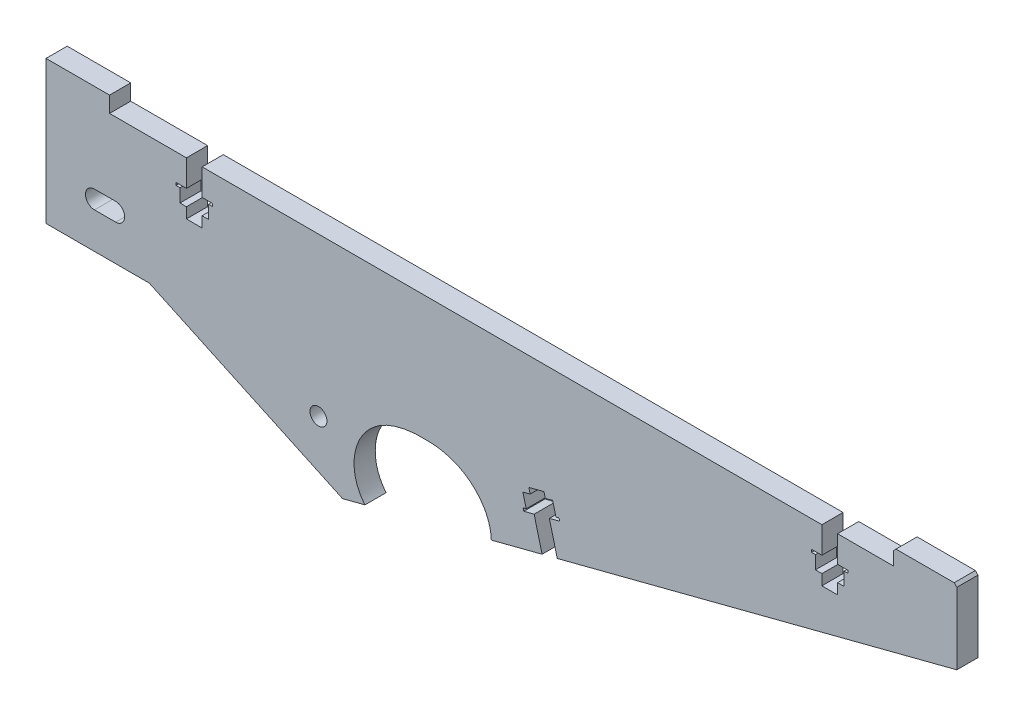
from build123d import *

# Parameters (mm, degrees)
BOSS_EXTRUDE1_DEPTH     = 4
CHAMFER2_SIZE           = 0.5
SKETCH3_R               = 10.5
CUT_EXTRUDE3_DEPTH      = 197.373771194
CUT_EXTRUDE4_DEPTH      = 10
CUT_EXTRUDE4_DEPTH_BACK = 10
CUT_EXTRUDE5_DEPTH      = 197.238646374
SKETCH10_R              = 1.6
CUT_EXTRUDE6_DEPTH      = 197.238646374


with BuildPart() as part:
    # Sketch1 → Boss-Extrude1 (new body)
    with BuildSketch(Plane.XY.offset(8.309736855)):
        Polygon((22.845082788, -6), (22.845082788, 18), (22.845082788, 21), (34.845082788, 21), (34.845082788, 18), (49.365082788, 18), (49.365082788, 13), (47.395082788, 13), (47.395082788, 12.5), (48.145082788, 12.5), (48.145082788, 10), (49.365082788, 10), (49.365082788, 8), (52.325082788, 8), (52.325082788, 10), (53.545082788, 10), (53.545082788, 12.5), (54.295082788, 12.5), (54.295082788, 13), (52.325082788, 13), (52.325082788, 18), (169.365082788, 18), (169.365082788, 13), (167.395082788, 13), (167.395082788, 12.5), (168.145082788, 12.5), (168.145082788, 10), (169.365082788, 10), (169.365082788, 8), (172.325082788, 8), (172.325082788, 10), (173.545082788, 10), (173.545082788, 12.5), (174.295082788, 12.5), (174.295082788, 13), (172.325082788, 13), (172.325082788, 18), (182.845082788, 18), (182.845082788, 21), (194.845082788, 21), (194.845082788, 7), (78.845082788, -23), (42.345082788, -6), align=None)
    extrude(amount=-BOSS_EXTRUDE1_DEPTH)

    # Chamfer2
    chamfer2_edges = [part.edges().sort_by_distance(p)[0] for p in [
        (194.845082788, 21, 6.309736855),
        (182.845082788, 21, 6.309736855),
    ]]
    chamfer(chamfer2_edges, length=CHAMFER2_SIZE)

    # Sketch3 → Cut-Extrude3 (cut, through all)
    with BuildSketch(Plane(origin=(0, 0, 0), x_dir=(0.8828029300332055, 0, -0.469743532924922), z_dir=(0.469743532924922, 0, 0.8828029300332055))):
        with Locations((80, -16)):
            Circle(SKETCH3_R)
    extrude(amount=CUT_EXTRUDE3_DEPTH, mode=Mode.SUBTRACT)

    # Sketch8 → Cut-Extrude4 (cut, two sides: drawn at the far end of the back side and taken through both)
    with BuildSketch(Plane.XY.offset(6.309736855).offset(-CUT_EXTRUDE4_DEPTH_BACK)):
        with BuildLine():
            Line((83.078885875, -21.905050926), (106.932277098, -15.736070437))
            add(Edge.make_bspline(
                [(83.078885875, -21.905050926), (80.532963305, -18.910538627), (80.417733199, -12.548003889), (86.17712083, -6.636548595), (91.208059023, -5.452656625), (95.836931271, -5.47393375), (99.842669118, -6.013485624), (104.914106357, -9.16127671), (106.884440122, -13.221037018), (106.932277098, -15.736070437)],
                knots=[0, 0, 0, 0, 0.25721618, 0.380775123, 0.549931934, 0.599416011, 0.704679704, 0.827401038, 1, 1, 1, 1], degree=3))
        make_face()
    extrude(amount=CUT_EXTRUDE4_DEPTH + CUT_EXTRUDE4_DEPTH_BACK, mode=Mode.SUBTRACT)

    # Sketch9 → Cut-Extrude5 (cut, through all)
    with BuildSketch(Plane.XY.offset(8.309736855)):
        with BuildLine():
            Line((32, 4.2), (36, 4.2))
            ThreePointArc((36, 4.2), (37.7, 2.5), (36, 0.8))
            Line((36, 0.8), (32, 0.8))
            ThreePointArc((32, 0.8), (30.3, 2.5), (32, 4.2))
        make_face()
    extrude(amount=-CUT_EXTRUDE5_DEPTH, mode=Mode.SUBTRACT)

    # Sketch10 → Cut-Extrude6 (cut, through all)
    with BuildSketch(Plane.XY.offset(8.309736855)):
        with Locations((74.297801815, -11.793568591)):
            Circle(SKETCH10_R)
        Polygon((119.394427065, -12.513100618), (117.892130133, -6.704219148), (119.847786894, -6.198445848), (119.722595483, -5.714372392), (119.141707336, -5.864602085), (118.515750281, -3.444234806), (117.140981667, -3.799778414), (116.890598845, -2.831631502), (114.024883986, -3.572764655), (114.275266808, -4.540911567), (112.900498194, -4.896455174), (113.526455249, -7.316822453), (112.945567102, -7.467052146), (113.070758513, -7.951125602), (115.026415274, -7.445352301), (116.528712206, -13.254233771), align=None)
    extrude(amount=-CUT_EXTRUDE6_DEPTH, mode=Mode.SUBTRACT)


solid = part.part
